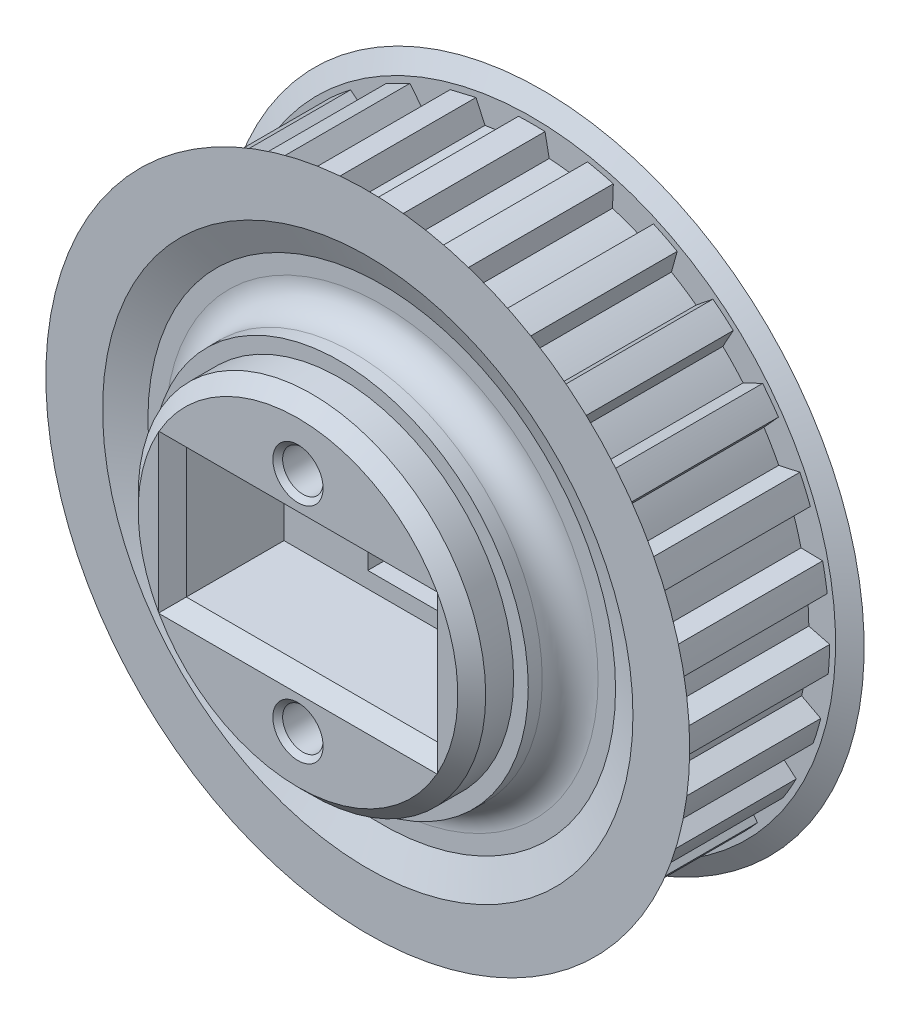
from build123d import *
from OCP.BRepFilletAPI import BRepFilletAPI_MakeChamfer
from build123d.topology import SkipClean

# Parameters (mm, degrees)
CROQUIS1_R                 = 1.5
SALIENTE_EXTRUIR1_DEPTH    = 11
CROQUIS2_R                 = 23.5
CROQUIS2_R_2               = 1.5
SALIENTE_EXTRUIR2_DEPTH    = 0.75
SALIENTE_EXTRUIR4_START    = 5.5
CROQUIS4_R                 = 12.35
CROQUIS4_R_2               = 1.5
SALIENTE_EXTRUIR4_DEPTH    = 5.5
SALIENTE_EXTRUIR6_START    = 0.75
CROQUIS6_R                 = 23.5
CROQUIS6_R_2               = 1.5
SALIENTE_EXTRUIR6_DEPTH    = 0.75
SKETCH6_R                  = 18.5
SKETCH6_R_2                = 12.35
CUT_EXTRUDE3_DEPTH         = 1
SALIENTE_EXTRUIR5_START    = 2.75
CROQUIS5_R                 = 13.5
CROQUIS5_R_2               = 1.5
SALIENTE_EXTRUIR5_DEPTH    = 2.75
CHAFL_N2_SIZE              = 1.732050808
CHAFL_N2_SIZE_2            = 1
CROQUIS3_R                 = 12.45
CROQUIS3_R_2               = 1.5
SALIENTE_EXTRUIR7_DEPTH    = 5
CUT_EXTRUDE4_START         = -1
SKETCH7_R                  = 19
SKETCH7_R_2                = 12.45
CUT_EXTRUDE4_DEPTH         = 1
CHAFL_N4_SIZE              = 1
CROQUIS7_R                 = 13.5
CROQUIS7_R_2               = 1.5
SALIENTE_EXTRUIR8_DEPTH    = 3
CORTAR_EXTRUIR1_DEPTH      = 37.670619111
CORTAR_EXTRUIR1_DEPTH_BACK = 37.670619111
CROQUIS8_R                 = 1.45
CROQUIS8_W                 = 6
CROQUIS8_H                 = 7
CROQUIS10_W                = 18
CROQUIS10_H                = 9.3
CORTAR_EXTRUIR3_DEPTH      = 8
CHAFL_N5_SIZE              = 1
SKETCH1_R                  = 12.35
SKETCH1_R_2                = 1.45
BOSS_EXTRUDE1_DEPTH        = 5
SKETCH2_R                  = 1.45
CUT_EXTRUDE1_DEPTH         = 40.487141021
SKETCH4_W                  = 6
SKETCH4_H                  = 7
CUT_EXTRUDE2_DEPTH         = 30
CHAMFER3_SIZE              = 1
CHAMFER2_SIZE              = 0.75
CHAMFER4_SIZE              = 2.246036774
CHAMFER4_SIZE_2            = 1
CHAMFER5_SIZE              = 0.35
FILLET1_R                  = 2


# Some blends are built 0.0001 mm under size
with BuildPart() as part:
    # Croquis1 → Saliente-Extruir1 (new body)
    with BuildSketch(Plane.XY):
        with BuildLine():
            Line((-0.95, 21.328853696), (-1.25, 19.810603222))
            ThreePointArc((-1.25, 19.810603222), (-2.304444345, 19.715781401), (-3.352333424, 19.564875686))
            Line((-3.352333424, 19.564875686), (-3.99437954, 20.973016762))
            Line((-3.99437954, 20.973016762), (-5.843164794, 20.534846607))
            Line((-5.843164794, 20.534846607), (-5.7849456, 18.988336009))
            ThreePointArc((-5.7849456, 18.988336009), (-6.789099845, 18.652898523), (-7.773941685, 18.264400638))
            Line((-7.773941685, 18.264400638), (-8.723421045, 19.486519065))
            Line((-8.723421045, 19.486519065), (-10.421323062, 18.633800623))
            Line((-10.421323062, 18.633800623), (-10.008023285, 17.142402688))
            ThreePointArc((-10.008023285, 17.142402688), (-10.907753215, 16.584433057), (-11.776454737, 15.979287025))
            Line((-11.776454737, 15.979287025), (-12.982180664, 16.949498081))
            ThreePointArc((-12.982180664, 16.949498081), (-13.723515467, 16.355048861), (-14.437665106, 15.728201623))
            Line((-14.437665106, 15.728201623), (-13.691565845, 14.372318001))
            ThreePointArc((-13.691565845, 14.372318001), (-14.438366785, 13.621896512), (-15.144096067, 12.832725911))
            Line((-15.144096067, 12.832725911), (-16.541067563, 13.498725269))
            ThreePointArc((-16.541067563, 13.498725269), (-17.125330165, 12.749335933), (-17.675668887, 11.974691203))
            Line((-17.675668887, 11.974691203), (-16.636992546, 10.82741793))
            ThreePointArc((-16.636992546, 10.82741793), (-17.190604265, 9.925), (-17.695315257, 8.994349223))
            Line((-17.695315257, 8.994349223), (-19.208221228, 9.320232683))
            ThreePointArc((-19.208221228, 9.320232683), (-19.603913882, 8.456303005), (-19.960772783, 7.57562208))
            Line((-19.960772783, 7.57562208), (-18.685514673, 6.698808955))
            ThreePointArc((-18.685514673, 6.698808955), (-19.016091819, 5.693044169), (-19.292575422, 4.671084839))
            Line((-19.292575422, 4.671084839), (-20.839854714, 4.639283941))
            ThreePointArc((-20.839854714, 4.639283941), (-21.025645527, 3.707388593), (-21.169786252, 2.768149211))
            Line((-21.169786252, 2.768149211), (-19.726695866, 2.209065457))
            ThreePointArc((-19.726695866, 2.209065457), (-19.816416942, 1.154174854), (-19.849767852, 0.096001063))
            Line((-19.849767852, 0.096001063), (-21.348006239, -0.291769799))
            ThreePointArc((-21.348006239, -0.291769799), (-21.313879179, -1.241392097), (-21.237531064, -2.188555299))
            Line((-21.237531064, -2.188555299), (-19.70440578, -2.399769333))
            ThreePointArc((-19.70440578, -2.399769333), (-19.548433897, -3.446916327), (-19.33685416, -4.484258155))
            Line((-19.33685416, -4.484258155), (-20.705281222, -5.207094153))
            ThreePointArc((-20.705281222, -5.207094153), (-20.453076088, -6.123249018), (-20.16035508, -7.027274227))
            Line((-20.16035508, -7.027274227), (-18.619846078, -6.879231936))
            ThreePointArc((-18.619846078, -6.879231936), (-18.226589722, -7.862183356), (-17.781485654, -8.822769856))
            Line((-17.781485654, -8.822769856), (-18.946329135, -9.841702715))
            ThreePointArc((-18.946329135, -9.841702715), (-18.489642371, -10.675), (-17.996329135, -11.487150982))
            Line((-17.996329135, -11.487150982), (-16.531485654, -10.987833365))
            ThreePointArc((-16.531485654, -10.987833365), (-15.922145376, -11.853598045), (-15.267512654, -12.68564375))
            Line((-15.267512654, -12.68564375), (-16.16597554, -13.945742535))
            ThreePointArc((-16.16597554, -13.945742535), (-15.529427248, -14.651258968), (-14.862116428, -15.327752454))
            Line((-14.862116428, -15.327752454), (-13.55190856, -14.504077854))
            ThreePointArc((-13.55190856, -14.504077854), (-12.759334052, -15.205982196), (-11.930464095, -15.864631306))
            Line((-11.930464095, -15.864631306), (-12.514110019, -17.297963766))
            ThreePointArc((-12.514110019, -17.297963766), (-11.732016682, -17.837664774), (-10.926683177, -18.342030824))
            Line((-10.926683177, -18.342030824), (-9.841744567, -17.238403751))
            ThreePointArc((-9.841744567, -17.238403751), (-8.908663727, -17.73860791), (-7.950241129, -18.188352481))
            Line((-7.950241129, -18.188352481), (-8.187605588, -19.717647292))
            ThreePointArc((-8.187605588, -19.717647292), (-7.30213006, -20.062437454), (-6.402189608, -20.367485564))
            Line((-6.402189608, -20.367485564), (-5.601009577, -19.04340284))
            ThreePointArc((-5.601009577, -19.04340284), (-4.577725034, -19.314940681), (-3.541418606, -19.531534867))
            Line((-3.541418606, -19.531534867), (-3.41970522, -21.074347349))
            ThreePointArc((-3.41970522, -21.074347349), (-2.478583717, -21.205638938), (-1.532552341, -21.294923886))
            Line((-1.532552341, -21.294923886), (-1.058322711, -19.821767152))
            ThreePointArc((-1.058322711, -19.821767152), (0, -19.85), (1.058322711, -19.821767152))
            Line((1.058322711, -19.821767152), (1.532552341, -21.294923886))
            ThreePointArc((1.532552341, -21.294923886), (2.478583717, -21.205638938), (3.41970522, -21.074347349))
            Line((3.41970522, -21.074347349), (3.541418606, -19.531534867))
            ThreePointArc((3.541418606, -19.531534867), (4.577725034, -19.314940681), (5.601009577, -19.04340284))
            Line((5.601009577, -19.04340284), (6.402189608, -20.367485564))
            ThreePointArc((6.402189608, -20.367485564), (7.30213006, -20.062437454), (8.187605588, -19.717647292))
            Line((8.187605588, -19.717647292), (7.950241129, -18.188352481))
            ThreePointArc((7.950241129, -18.188352481), (8.908663727, -17.73860791), (9.841744567, -17.238403751))
            Line((9.841744567, -17.238403751), (10.926683177, -18.342030824))
            ThreePointArc((10.926683177, -18.342030824), (11.732016682, -17.837664774), (12.514110019, -17.297963766))
            Line((12.514110019, -17.297963766), (11.930464095, -15.864631306))
            ThreePointArc((11.930464095, -15.864631306), (12.759334052, -15.205982196), (13.55190856, -14.504077854))
            Line((13.55190856, -14.504077854), (14.862116428, -15.327752454))
            ThreePointArc((14.862116428, -15.327752454), (15.529427248, -14.651258968), (16.16597554, -13.945742535))
            Line((16.16597554, -13.945742535), (15.267512654, -12.68564375))
            ThreePointArc((15.267512654, -12.68564375), (15.922145376, -11.853598045), (16.531485654, -10.987833365))
            Line((16.531485654, -10.987833365), (17.996329135, -11.487150982))
            ThreePointArc((17.996329135, -11.487150982), (18.489642371, -10.675), (18.946329135, -9.841702715))
            Line((18.946329135, -9.841702715), (17.781485654, -8.822769856))
            ThreePointArc((17.781485654, -8.822769856), (18.226589722, -7.862183356), (18.619846078, -6.879231936))
            Line((18.619846078, -6.879231936), (20.16035508, -7.027274227))
            ThreePointArc((20.16035508, -7.027274227), (20.453076088, -6.123249018), (20.705281222, -5.207094153))
            Line((20.705281222, -5.207094153), (19.33685416, -4.484258155))
            ThreePointArc((19.33685416, -4.484258155), (19.548433897, -3.446916327), (19.70440578, -2.399769333))
            Line((19.70440578, -2.399769333), (21.237531064, -2.188555299))
            ThreePointArc((21.237531064, -2.188555299), (21.313879179, -1.241392097), (21.348006239, -0.291769799))
            Line((21.348006239, -0.291769799), (19.849767852, 0.096001063))
            ThreePointArc((19.849767852, 0.096001063), (19.816416942, 1.154174854), (19.726695866, 2.209065457))
            Line((19.726695866, 2.209065457), (21.169786252, 2.768149211))
            ThreePointArc((21.169786252, 2.768149211), (21.025645527, 3.707388593), (20.839854714, 4.639283941))
            Line((20.839854714, 4.639283941), (19.292575422, 4.671084839))
            ThreePointArc((19.292575422, 4.671084839), (19.016091819, 5.693044169), (18.685514673, 6.698808955))
            Line((18.685514673, 6.698808955), (19.960772783, 7.57562208))
            ThreePointArc((19.960772783, 7.57562208), (19.603913882, 8.456303005), (19.208221228, 9.320232683))
            Line((19.208221228, 9.320232683), (17.695315257, 8.994349223))
            ThreePointArc((17.695315257, 8.994349223), (17.190604265, 9.925), (16.636992546, 10.82741793))
            Line((16.636992546, 10.82741793), (17.675668887, 11.974691203))
            ThreePointArc((17.675668887, 11.974691203), (17.125330165, 12.749335933), (16.541067563, 13.498725269))
            Line((16.541067563, 13.498725269), (15.144096067, 12.832725911))
            ThreePointArc((15.144096067, 12.832725911), (14.438366785, 13.621896512), (13.691565845, 14.372318001))
            Line((13.691565845, 14.372318001), (14.437665106, 15.728201623))
            ThreePointArc((14.437665106, 15.728201623), (13.723515467, 16.355048861), (12.982180664, 16.949498081))
            Line((12.982180664, 16.949498081), (11.776454737, 15.979287025))
            ThreePointArc((11.776454737, 15.979287025), (10.907753215, 16.584433057), (10.008023285, 17.142402688))
            Line((10.008023285, 17.142402688), (10.421323062, 18.633800623))
            ThreePointArc((10.421323062, 18.633800623), (9.581862497, 19.079056871), (8.723421045, 19.486519065))
            Line((8.723421045, 19.486519065), (7.773941685, 18.264400638))
            ThreePointArc((7.773941685, 18.264400638), (6.789099845, 18.652898523), (5.7849456, 18.988336009))
            Line((5.7849456, 18.988336009), (5.843164794, 20.534846607))
            ThreePointArc((5.843164794, 20.534846607), (4.92364884, 20.774507987), (3.99437954, 20.973016762))
            Line((3.99437954, 20.973016762), (3.352333424, 19.564875686))
            ThreePointArc((3.352333424, 19.564875686), (2.304444345, 19.715781401), (1.25, 19.810603222))
            Line((1.25, 19.810603222), (0.95, 21.328853696))
            ThreePointArc((0.95, 21.328853696), (0, 21.35), (-0.95, 21.328853696))
        make_face()
        Circle(CROQUIS1_R, mode=Mode.SUBTRACT)
    extrude(amount=SALIENTE_EXTRUIR1_DEPTH)

    # Croquis2 → Saliente-Extruir2 (add)
    with BuildSketch(Plane.XY.offset(11)):
        Circle(CROQUIS2_R)
        Circle(CROQUIS2_R_2, mode=Mode.SUBTRACT)
    extrude(amount=SALIENTE_EXTRUIR2_DEPTH)

    # Croquis4 → Saliente-Extruir4 (add)
    with BuildSketch(Plane(origin=(0, 0, 0), x_dir=(-1, 0, 0), z_dir=(0, 0, -1)).offset(SALIENTE_EXTRUIR4_START)):
        with Locations(Location((0, 0, 0), (0, 0, 180))):
            Circle(CROQUIS4_R)
        Circle(CROQUIS4_R_2, mode=Mode.SUBTRACT)
    extrude(amount=-SALIENTE_EXTRUIR4_DEPTH)

    # Croquis6 → Saliente-Extruir6 (add)
    with SkipClean():  # the faces are left unmerged after this step: merging them gives an invalid solid
        with BuildSketch(Plane(origin=(0, 0, 0), x_dir=(-1, 0, 0), z_dir=(0, 0, -1)).offset(SALIENTE_EXTRUIR6_START)):
            with Locations(Location((0, 0, 0), (0, 0, 180))):
                Circle(CROQUIS6_R)
            Circle(CROQUIS6_R_2, mode=Mode.SUBTRACT)
        extrude(amount=-SALIENTE_EXTRUIR6_DEPTH)

    # Sketch6 → Cut-Extrude3 (cut)
    with SkipClean():  # the faces are left unmerged after this step: merging them gives an invalid solid
        with BuildSketch(Plane(origin=(0, 0, -0.75), x_dir=(-1, 0, 0), z_dir=(0, 0, -1))):
            Circle(SKETCH6_R)
            Circle(SKETCH6_R_2, mode=Mode.SUBTRACT)
        extrude(amount=-CUT_EXTRUDE3_DEPTH, mode=Mode.SUBTRACT)

    # Croquis5 → Saliente-Extruir5 (add)
    with BuildSketch(Plane(origin=(0, 0, 0.25), x_dir=(-1, 0, 0), z_dir=(0, 0, -1)).offset(SALIENTE_EXTRUIR5_START)):
        Circle(CROQUIS5_R)
        Circle(CROQUIS5_R_2, mode=Mode.SUBTRACT)
    extrude(amount=-SALIENTE_EXTRUIR5_DEPTH)

    # Chaflán2
    # the kernel refuses this chamfer: 1.732050808, 1 mm, written as the material it takes off along each edge
    with BuildSketch(Plane(origin=(0, 0, 0), x_dir=(1, 0, 0), z_dir=(0, 1, 0))) as chafl_n2_piece_1:
        Polygon((23.5 - CHAFL_N2_SIZE, 0), (23.5, CHAFL_N2_SIZE_2), (23.5, 0), align=None)
    revolve(axis=Axis((0, 0, 0), (0, 0, -1)), mode=Mode.SUBTRACT)
    with BuildSketch(Plane(origin=(0, 0, 11), x_dir=(1, 0, 0), z_dir=(0, -1, 0))) as chafl_n2_piece_2:
        Polygon((23.5 - CHAFL_N2_SIZE, 0), (23.5, CHAFL_N2_SIZE_2), (23.5, 0), align=None)
    revolve(axis=Axis((0, 0, 11), (0, 0, 1)), mode=Mode.SUBTRACT)

    # Croquis3 → Saliente-Extruir7 (add)
    with BuildSketch(Plane.XY.offset(11.75)):
        Circle(CROQUIS3_R)
        with Locations(Location((0, 0, 0), (0, 0, 180))):
            Circle(CROQUIS3_R_2, mode=Mode.SUBTRACT)
    extrude(amount=SALIENTE_EXTRUIR7_DEPTH)

    # Sketch7 → Cut-Extrude4 (cut)
    with BuildSketch(Plane.XY.offset(11.75).offset(CUT_EXTRUDE4_START)):
        Circle(SKETCH7_R)
        Circle(SKETCH7_R_2, mode=Mode.SUBTRACT)
    extrude(amount=CUT_EXTRUDE4_DEPTH, mode=Mode.SUBTRACT)

    # Chaflán4
    chafl_n4_edges = [part.edges().sort_by_distance(p)[0] for p in [
        (-12.45, 0, 16.75),
    ]]
    chamfer(chafl_n4_edges, length=CHAFL_N4_SIZE)

    # Croquis7 → Saliente-Extruir8 (add)
    with BuildSketch(Plane.XY.offset(10.75)):
        with Locations(Location((0, 0, 0), (0, 0, 180))):
            Circle(CROQUIS7_R)
        with Locations(Location((0, 0, 0), (0, 0, 180))):
            Circle(CROQUIS7_R_2, mode=Mode.SUBTRACT)
    extrude(amount=SALIENTE_EXTRUIR8_DEPTH)

    # Croquis8 → Cortar-Extruir1 (cut, two sides: drawn at the far end of the back side and taken through both)
    with BuildSketch(Plane.XY.offset(-CORTAR_EXTRUIR1_DEPTH_BACK)):
        with Locations((0, 8)):
            Circle(CROQUIS8_R)
        with Locations((0, -8)):
            Circle(CROQUIS8_R)
        Rectangle(CROQUIS8_W, CROQUIS8_H)
    extrude(amount=CORTAR_EXTRUIR1_DEPTH + CORTAR_EXTRUIR1_DEPTH_BACK, mode=Mode.SUBTRACT)

    # Croquis10 → Cortar-Extruir3 (cut)
    with BuildSketch(Plane.XY.offset(16.75)):
        Rectangle(CROQUIS10_W, CROQUIS10_H)
    extrude(amount=-CORTAR_EXTRUIR3_DEPTH, mode=Mode.SUBTRACT)

    # Chaflán5
    # the kernel refuses this chamfer: 1 mm, written as the material it takes off along each edge
    with BuildSketch(Plane(origin=(3, 3.5, -5.5), x_dir=(0.9996219169112968, 0, -0.027495876610586487), z_dir=(0, -1, 0)), Plane(origin=(-3, -3.5, -5.5), x_dir=(-0.9996219169112968, 0, -0.027495876610586487), z_dir=(0, 1, 0))) as chafl_n5_piece_1:
        Polygon((CHAFL_N5_SIZE * 0.999621916911, CHAFL_N5_SIZE * 0.0274958766106), (-CHAFL_N5_SIZE * 0.0274958766106, CHAFL_N5_SIZE * 0.999621916911), (0, 0), align=None)
    extrude(amount=7, mode=Mode.SUBTRACT)
    with BuildSketch(Plane(origin=(3, -3.5, -5.5), x_dir=(0, -0.9996219169112968, -0.027495876610586473), z_dir=(-1, 0, 0)), Plane(origin=(-3, 3.5, -5.5), x_dir=(0, 0.9996219169112968, -0.027495876610586487), z_dir=(1, 0, 0))) as chafl_n5_piece_2:
        Polygon((CHAFL_N5_SIZE * 0.999621916911, CHAFL_N5_SIZE * 0.0274958766106), (-CHAFL_N5_SIZE * 0.0274958766106, CHAFL_N5_SIZE * 0.999621916911), (0, 0), align=None)
    extrude(amount=6, mode=Mode.SUBTRACT)
    with BuildSketch(Plane(origin=(-9, 4.65, 16.75), x_dir=(-0.9996219169112968, 0, 0.027495876610585647), z_dir=(0, -1, 0)), Plane(origin=(9, -4.65, 16.75), x_dir=(0.9996219169112968, 0, 0.027495876610585647), z_dir=(0, 1, 0))) as chafl_n5_piece_3:
        Polygon((CHAFL_N5_SIZE * 0.999621916911, CHAFL_N5_SIZE * 0.0274958766106), (-CHAFL_N5_SIZE * 0.0274958766106, CHAFL_N5_SIZE * 0.999621916911), (0, 0), align=None)
    extrude(amount=9.3, mode=Mode.SUBTRACT)
    with BuildSketch(Plane(origin=(-9, -4.65, 16.75), x_dir=(0, -0.9996219169112968, 0.027495876610585623), z_dir=(1, 0, 0)), Plane(origin=(9, 4.65, 16.75), x_dir=(0, 0.9996219169112968, 0.027495876610585623), z_dir=(-1, 0, 0))) as chafl_n5_piece_4:
        Polygon((CHAFL_N5_SIZE * 0.999621916911, CHAFL_N5_SIZE * 0.0274958766106), (-CHAFL_N5_SIZE * 0.0274958766106, CHAFL_N5_SIZE * 0.999621916911), (0, 0), align=None)
    extrude(amount=18, mode=Mode.SUBTRACT)
    with BuildSketch(Plane(origin=(-3, 3.5, -5.5), x_dir=(0, 0.9996219169112968, -0.027495876610586487), z_dir=(1, 0, 0))) as chafl_n5_piece_5a_section:
        Polygon((CHAFL_N5_SIZE * 0.999621916911, CHAFL_N5_SIZE * 0.0274958766106), (-CHAFL_N5_SIZE * 0.0274958766106, CHAFL_N5_SIZE * 0.999621916911), (0, 0), align=None)
    chafl_n5_piece_5a = extrude(amount=8.571682988, mode=Mode.PRIVATE)
    chafl_n5_piece_5a = split(chafl_n5_piece_5a, bisect_by=Plane(origin=(3, 3.829793627, -5.170206373), z_dir=(1, 0, 0)), keep=Keep.TOP, mode=Mode.PRIVATE)
    with BuildSketch(Plane(origin=(3, 6.071682988, -5.5), x_dir=(0.9996219169112968, 0, -0.027495876610586487), z_dir=(0, -1, 0))) as chafl_n5_piece_5b_section:
        Polygon((CHAFL_N5_SIZE * 0.999621916911, CHAFL_N5_SIZE * 0.0274958766106), (-CHAFL_N5_SIZE * 0.0274958766106, CHAFL_N5_SIZE * 0.999621916911), (0, 0), align=None)
    chafl_n5_piece_5b = extrude(amount=9.571682988, mode=Mode.PRIVATE)
    chafl_n5_piece_5b = split(chafl_n5_piece_5b, bisect_by=Plane(origin=(3.329793627, 3.5, -5.170206373), z_dir=(0, 1, 0)), keep=Keep.TOP, mode=Mode.PRIVATE)
    chafl_n5_piece_5 = chafl_n5_piece_5a & chafl_n5_piece_5b
    add(chafl_n5_piece_5, mode=Mode.SUBTRACT)
    with BuildSketch(Plane(origin=(3, 3.5, -5.5), x_dir=(0.9996219169112968, 0, -0.027495876610586487), z_dir=(0, -1, 0))) as chafl_n5_piece_6a_section:
        Polygon((CHAFL_N5_SIZE * 0.999621916911, CHAFL_N5_SIZE * 0.0274958766106), (-CHAFL_N5_SIZE * 0.0274958766106, CHAFL_N5_SIZE * 0.999621916911), (0, 0), align=None)
    chafl_n5_piece_6a = extrude(amount=9.571682988, mode=Mode.PRIVATE)
    chafl_n5_piece_6a = split(chafl_n5_piece_6a, bisect_by=Plane(origin=(3.329793627, -3.5, -5.170206373), z_dir=(0, -1, 0)), keep=Keep.TOP, mode=Mode.PRIVATE)
    with BuildSketch(Plane(origin=(5.571682988, -3.5, -5.5), x_dir=(0, -0.9996219169112968, -0.027495876610586473), z_dir=(-1, 0, 0))) as chafl_n5_piece_6b_section:
        Polygon((CHAFL_N5_SIZE * 0.999621916911, CHAFL_N5_SIZE * 0.0274958766106), (-CHAFL_N5_SIZE * 0.0274958766106, CHAFL_N5_SIZE * 0.999621916911), (0, 0), align=None)
    chafl_n5_piece_6b = extrude(amount=8.571682988, mode=Mode.PRIVATE)
    chafl_n5_piece_6b = split(chafl_n5_piece_6b, bisect_by=Plane(origin=(3, -3.829793627, -5.170206373), z_dir=(1, 0, 0)), keep=Keep.TOP, mode=Mode.PRIVATE)
    chafl_n5_piece_6 = chafl_n5_piece_6a & chafl_n5_piece_6b
    add(chafl_n5_piece_6, mode=Mode.SUBTRACT)
    with BuildSketch(Plane(origin=(3, -3.5, -5.5), x_dir=(0, -0.9996219169112968, -0.027495876610586473), z_dir=(-1, 0, 0))) as chafl_n5_piece_7a_section:
        Polygon((CHAFL_N5_SIZE * 0.999621916911, CHAFL_N5_SIZE * 0.0274958766106), (-CHAFL_N5_SIZE * 0.0274958766106, CHAFL_N5_SIZE * 0.999621916911), (0, 0), align=None)
    chafl_n5_piece_7a = extrude(amount=8.571682988, mode=Mode.PRIVATE)
    chafl_n5_piece_7a = split(chafl_n5_piece_7a, bisect_by=Plane(origin=(-3, -3.829793627, -5.170206373), z_dir=(-1, 0, 0)), keep=Keep.TOP, mode=Mode.PRIVATE)
    with BuildSketch(Plane(origin=(-3, -6.071682988, -5.5), x_dir=(-0.9996219169112968, 0, -0.027495876610586487), z_dir=(0, 1, 0))) as chafl_n5_piece_7b_section:
        Polygon((CHAFL_N5_SIZE * 0.999621916911, CHAFL_N5_SIZE * 0.0274958766106), (-CHAFL_N5_SIZE * 0.0274958766106, CHAFL_N5_SIZE * 0.999621916911), (0, 0), align=None)
    chafl_n5_piece_7b = extrude(amount=9.571682988, mode=Mode.PRIVATE)
    chafl_n5_piece_7b = split(chafl_n5_piece_7b, bisect_by=Plane(origin=(-3.329793627, -3.5, -5.170206373), z_dir=(0, -1, 0)), keep=Keep.TOP, mode=Mode.PRIVATE)
    chafl_n5_piece_7 = chafl_n5_piece_7a & chafl_n5_piece_7b
    add(chafl_n5_piece_7, mode=Mode.SUBTRACT)
    with BuildSketch(Plane(origin=(-5.571682988, 3.5, -5.5), x_dir=(0, 0.9996219169112968, -0.027495876610586487), z_dir=(1, 0, 0))) as chafl_n5_piece_8a_section:
        Polygon((CHAFL_N5_SIZE * 0.999621916911, CHAFL_N5_SIZE * 0.0274958766106), (-CHAFL_N5_SIZE * 0.0274958766106, CHAFL_N5_SIZE * 0.999621916911), (0, 0), align=None)
    chafl_n5_piece_8a = extrude(amount=8.571682988, mode=Mode.PRIVATE)
    chafl_n5_piece_8a = split(chafl_n5_piece_8a, bisect_by=Plane(origin=(-3, 3.829793627, -5.170206373), z_dir=(-1, 0, 0)), keep=Keep.TOP, mode=Mode.PRIVATE)
    with BuildSketch(Plane(origin=(-3, -3.5, -5.5), x_dir=(-0.9996219169112968, 0, -0.027495876610586487), z_dir=(0, 1, 0))) as chafl_n5_piece_8b_section:
        Polygon((CHAFL_N5_SIZE * 0.999621916911, CHAFL_N5_SIZE * 0.0274958766106), (-CHAFL_N5_SIZE * 0.0274958766106, CHAFL_N5_SIZE * 0.999621916911), (0, 0), align=None)
    chafl_n5_piece_8b = extrude(amount=9.571682988, mode=Mode.PRIVATE)
    chafl_n5_piece_8b = split(chafl_n5_piece_8b, bisect_by=Plane(origin=(-3.329793627, 3.5, -5.170206373), z_dir=(0, 1, 0)), keep=Keep.TOP, mode=Mode.PRIVATE)
    chafl_n5_piece_8 = chafl_n5_piece_8a & chafl_n5_piece_8b
    add(chafl_n5_piece_8, mode=Mode.SUBTRACT)
    with BuildSketch(Plane(origin=(9, 4.65, 16.75), x_dir=(0, 0.9996219169112968, 0.027495876610585623), z_dir=(-1, 0, 0))) as chafl_n5_piece_9a_section:
        Polygon((CHAFL_N5_SIZE * 0.999621916911, CHAFL_N5_SIZE * 0.0274958766106), (-CHAFL_N5_SIZE * 0.0274958766106, CHAFL_N5_SIZE * 0.999621916911), (0, 0), align=None)
    chafl_n5_piece_9a = extrude(amount=20.571682988, mode=Mode.PRIVATE)
    chafl_n5_piece_9a = split(chafl_n5_piece_9a, bisect_by=Plane(origin=(-9, 4.979793627, 16.420206373), z_dir=(-1, 0, 0)), keep=Keep.TOP, mode=Mode.PRIVATE)
    with BuildSketch(Plane(origin=(-9, 7.221682988, 16.75), x_dir=(-0.9996219169112968, 0, 0.027495876610585647), z_dir=(0, -1, 0))) as chafl_n5_piece_9b_section:
        Polygon((CHAFL_N5_SIZE * 0.999621916911, CHAFL_N5_SIZE * 0.0274958766106), (-CHAFL_N5_SIZE * 0.0274958766106, CHAFL_N5_SIZE * 0.999621916911), (0, 0), align=None)
    chafl_n5_piece_9b = extrude(amount=11.871682988, mode=Mode.PRIVATE)
    chafl_n5_piece_9b = split(chafl_n5_piece_9b, bisect_by=Plane(origin=(-9.329793627, 4.65, 16.420206373), z_dir=(0, 1, 0)), keep=Keep.TOP, mode=Mode.PRIVATE)
    chafl_n5_piece_9 = chafl_n5_piece_9a & chafl_n5_piece_9b
    add(chafl_n5_piece_9, mode=Mode.SUBTRACT)
    with BuildSketch(Plane(origin=(-9, 4.65, 16.75), x_dir=(-0.9996219169112968, 0, 0.027495876610585647), z_dir=(0, -1, 0))) as chafl_n5_piece_10a_section:
        Polygon((CHAFL_N5_SIZE * 0.999621916911, CHAFL_N5_SIZE * 0.0274958766106), (-CHAFL_N5_SIZE * 0.0274958766106, CHAFL_N5_SIZE * 0.999621916911), (0, 0), align=None)
    chafl_n5_piece_10a = extrude(amount=11.871682988, mode=Mode.PRIVATE)
    chafl_n5_piece_10a = split(chafl_n5_piece_10a, bisect_by=Plane(origin=(-9.329793627, -4.65, 16.420206373), z_dir=(0, -1, 0)), keep=Keep.TOP, mode=Mode.PRIVATE)
    with BuildSketch(Plane(origin=(-11.571682988, -4.65, 16.75), x_dir=(0, -0.9996219169112968, 0.027495876610585623), z_dir=(1, 0, 0))) as chafl_n5_piece_10b_section:
        Polygon((CHAFL_N5_SIZE * 0.999621916911, CHAFL_N5_SIZE * 0.0274958766106), (-CHAFL_N5_SIZE * 0.0274958766106, CHAFL_N5_SIZE * 0.999621916911), (0, 0), align=None)
    chafl_n5_piece_10b = extrude(amount=20.571682988, mode=Mode.PRIVATE)
    chafl_n5_piece_10b = split(chafl_n5_piece_10b, bisect_by=Plane(origin=(-9, -4.979793627, 16.420206373), z_dir=(-1, 0, 0)), keep=Keep.TOP, mode=Mode.PRIVATE)
    chafl_n5_piece_10 = chafl_n5_piece_10a & chafl_n5_piece_10b
    add(chafl_n5_piece_10, mode=Mode.SUBTRACT)
    with BuildSketch(Plane(origin=(-9, -4.65, 16.75), x_dir=(0, -0.9996219169112968, 0.027495876610585623), z_dir=(1, 0, 0))) as chafl_n5_piece_11a_section:
        Polygon((CHAFL_N5_SIZE * 0.999621916911, CHAFL_N5_SIZE * 0.0274958766106), (-CHAFL_N5_SIZE * 0.0274958766106, CHAFL_N5_SIZE * 0.999621916911), (0, 0), align=None)
    chafl_n5_piece_11a = extrude(amount=20.571682988, mode=Mode.PRIVATE)
    chafl_n5_piece_11a = split(chafl_n5_piece_11a, bisect_by=Plane(origin=(9, -4.979793627, 16.420206373), z_dir=(1, 0, 0)), keep=Keep.TOP, mode=Mode.PRIVATE)
    with BuildSketch(Plane(origin=(9, -7.221682988, 16.75), x_dir=(0.9996219169112968, 0, 0.027495876610585647), z_dir=(0, 1, 0))) as chafl_n5_piece_11b_section:
        Polygon((CHAFL_N5_SIZE * 0.999621916911, CHAFL_N5_SIZE * 0.0274958766106), (-CHAFL_N5_SIZE * 0.0274958766106, CHAFL_N5_SIZE * 0.999621916911), (0, 0), align=None)
    chafl_n5_piece_11b = extrude(amount=11.871682988, mode=Mode.PRIVATE)
    chafl_n5_piece_11b = split(chafl_n5_piece_11b, bisect_by=Plane(origin=(9.329793627, -4.65, 16.420206373), z_dir=(0, -1, 0)), keep=Keep.TOP, mode=Mode.PRIVATE)
    chafl_n5_piece_11 = chafl_n5_piece_11a & chafl_n5_piece_11b
    add(chafl_n5_piece_11, mode=Mode.SUBTRACT)
    with BuildSketch(Plane(origin=(11.571682988, 4.65, 16.75), x_dir=(0, 0.9996219169112968, 0.027495876610585623), z_dir=(-1, 0, 0))) as chafl_n5_piece_12a_section:
        Polygon((CHAFL_N5_SIZE * 0.999621916911, CHAFL_N5_SIZE * 0.0274958766106), (-CHAFL_N5_SIZE * 0.0274958766106, CHAFL_N5_SIZE * 0.999621916911), (0, 0), align=None)
    chafl_n5_piece_12a = extrude(amount=20.571682988, mode=Mode.PRIVATE)
    chafl_n5_piece_12a = split(chafl_n5_piece_12a, bisect_by=Plane(origin=(9, 4.979793627, 16.420206373), z_dir=(1, 0, 0)), keep=Keep.TOP, mode=Mode.PRIVATE)
    with BuildSketch(Plane(origin=(9, -4.65, 16.75), x_dir=(0.9996219169112968, 0, 0.027495876610585647), z_dir=(0, 1, 0))) as chafl_n5_piece_12b_section:
        Polygon((CHAFL_N5_SIZE * 0.999621916911, CHAFL_N5_SIZE * 0.0274958766106), (-CHAFL_N5_SIZE * 0.0274958766106, CHAFL_N5_SIZE * 0.999621916911), (0, 0), align=None)
    chafl_n5_piece_12b = extrude(amount=11.871682988, mode=Mode.PRIVATE)
    chafl_n5_piece_12b = split(chafl_n5_piece_12b, bisect_by=Plane(origin=(9.329793627, 4.65, 16.420206373), z_dir=(0, 1, 0)), keep=Keep.TOP, mode=Mode.PRIVATE)
    chafl_n5_piece_12 = chafl_n5_piece_12a & chafl_n5_piece_12b
    add(chafl_n5_piece_12, mode=Mode.SUBTRACT)

    # Sketch1 → Boss-Extrude1 (add)
    with BuildSketch(Plane(origin=(0, 0, -5.5), x_dir=(-1, 0, 0), z_dir=(0, 0, -1))):
        Circle(SKETCH1_R)
        with Locations(Location((0, 8, 0), (0, 0, 180))):
            Circle(SKETCH1_R_2, mode=Mode.SUBTRACT)
        with Locations(Location((0, -8, 0), (0, 0, 180))):
            Circle(SKETCH1_R_2, mode=Mode.SUBTRACT)
    extrude(amount=-BOSS_EXTRUDE1_DEPTH)

    # Sketch2 → Cut-Extrude1 (cut, through all)
    with BuildSketch(Plane(origin=(0, 0, -5.5), x_dir=(-1, 0, 0), z_dir=(0, 0, -1))):
        with Locations((-6.5, 0)):
            Circle(SKETCH2_R)
        with Locations((6.5, 0)):
            Circle(SKETCH2_R)
    extrude(amount=-CUT_EXTRUDE1_DEPTH, mode=Mode.SUBTRACT)

    # Sketch4 → Cut-Extrude2 (cut)
    with BuildSketch(Plane.XY.offset(16.75)):
        Rectangle(SKETCH4_W, SKETCH4_H)
    extrude(amount=-CUT_EXTRUDE2_DEPTH, mode=Mode.SUBTRACT)

    # Chamfer3
    chamfer3_edges = [part.edges().sort_by_distance(p)[0] for p in [
        (-3, 0, -5.5),
        (0, 3.5, -5.5),
        (3, 0, -5.5),
        (0, -3.5, -5.5),
    ]]
    chamfer(chamfer3_edges, length=CHAMFER3_SIZE - 0.0001)  # a hair under: the kernel refuses the full size

    # Chamfer2
    chamfer2_edges = [part.edges().sort_by_distance(p)[0] for p in [
        (-12.35, 0, -5.5),
    ]]
    chamfer(chamfer2_edges, length=CHAMFER2_SIZE)

    # Chamfer4
    chamfer4_edges_1 = [part.edges().sort_by_distance(p)[0] for p in [
        (18.5, 0, 0.25),
    ]]
    chamfer4_side_1 = [part.faces().sort_by_distance(p)[0] for p in [
        (18.48, 0, 0.25),
    ]]
    chamfer4_edges_2 = [part.edges().sort_by_distance(p)[0] for p in [
        (-19, 0, 10.75),
    ]]
    chamfer4_side_2 = [part.faces().sort_by_distance(p)[0] for p in [
        (-18.98, 0, 10.75),
    ]]
    chamfer4 = BRepFilletAPI_MakeChamfer(part.part.solid().wrapped)
    for e in chamfer4_edges_1:
        chamfer4.Add(CHAMFER4_SIZE - 0.0001, CHAMFER4_SIZE_2 - 0.0001, e.wrapped, chamfer4_side_1[0].wrapped)
    for e in chamfer4_edges_2:
        chamfer4.Add(CHAMFER4_SIZE - 0.0001, CHAMFER4_SIZE_2 - 0.0001, e.wrapped, chamfer4_side_2[0].wrapped)
    add(Compound.cast(chamfer4.Shape()), mode=Mode.REPLACE)  # a hair under: the kernel refuses the full size

    # Chamfer5
    chamfer5_edges = [part.edges().sort_by_distance(p)[0] for p in [
        (-1.45, -8, -5.5),
        (-1.45, -8, 16.75),
        (-1.45, 8, -5.5),
        (-1.45, 8, 16.75),
        (7.95, 0, 8.75),
        (7.95, 0, -5.5),
        (-5.05, 0, 8.75),
        (-5.05, 0, -5.5),
    ]]
    chamfer(chamfer5_edges, length=CHAMFER5_SIZE)

    # Fillet1
    fillet1_edges = [part.edges().sort_by_distance(p)[0] for p in [
        (13.5, 0, 0.25),
        (13.5, 0, 10.75),
    ]]
    fillet(fillet1_edges, radius=FILLET1_R)


solid = part.part
